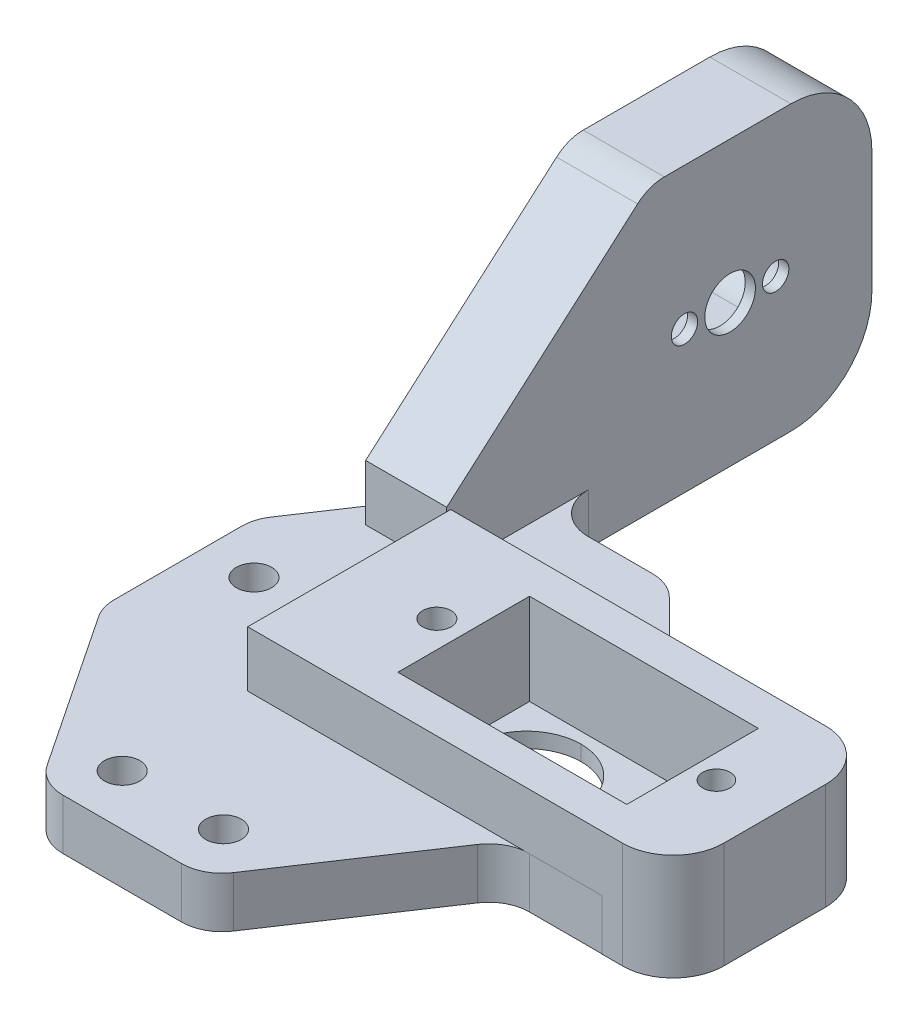
from build123d import *

# Parameters (mm, degrees)
BOSS_EXTRUDE1_DEPTH = 5
SKETCH2_R           = 1.75
SKETCH2_W           = 10.8
SKETCH2_H           = 10.8
CUT_EXTRUDE1_DEPTH  = 54.252895531
FILLET1_R           = 5.4
FILLET2_R           = 5.4
FILLET3_RADIUS      = 10
FILLET3_LENGTH      = 5
SKETCH6_W           = 35
SKETCH6_H           = 20.042215846
SKETCH6_W_2         = 23
SKETCH6_H_2         = 13
BOSS_EXTRUDE3_DEPTH = 5.5
SKETCH7_W           = 23
SKETCH7_H           = 13
CUT_EXTRUDE3_DEPTH  = 3.5
CUT_EXTRUDE4_DEPTH  = 54.302165833
SKETCH9_W           = 8
SKETCH9_H           = 28
BOSS_EXTRUDE4_DEPTH = 32
SKETCH11_R          = 2.5
SKETCH11_R_2        = 1.3
CUT_EXTRUDE5_DEPTH  = 69.854164991
FILLET6_R           = 8
BOSS_EXTRUDE5_DEPTH = 8
SKETCH13_W          = 14
SKETCH13_H          = 7
CUT_EXTRUDE6_DEPTH  = 7
FILLET7_R           = 3.5
FILLET8_R           = 3.5
CUT_EXTRUDE7_DEPTH  = 74.28896148
FILLET9_R           = 4
SKETCH15_W          = 5.3
SKETCH15_H          = 13
SKETCH15_R          = 1.4
BOSS_EXTRUDE6_DEPTH = 9
SKETCH16_W          = 7
SKETCH16_H          = 20.042215846
BOSS_EXTRUDE7_DEPTH = 10.5
SKETCH17_R          = 1.35
CUT_EXTRUDE8_DEPTH  = 9
FILLET10_R          = 5
SKETCH18_W          = 4.9
SKETCH18_H          = 13
CUT_EXTRUDE9_DEPTH  = 9


# Some blends are built 0.0001 mm under size
with BuildPart() as part:
    # Sketch1 → Boss-Extrude1 (new body)
    with BuildSketch(Plane(origin=(0, 0, 0), x_dir=(1, 0, 0), z_dir=(0, 1, 0))):
        Polygon((45, -10), (45, 10), (21, 10), (11.001510114, 19.998489886), (-4.998489886, 19.998489886), (-14.999716743, 4.996611292), (-14.999716743, -10.003388708), (-2.979747437, -28.033388708), (13.020252563, -28.033388708), (25.042481003, -10), align=None)
    extrude(amount=BOSS_EXTRUDE1_DEPTH)

    # Sketch2 → Cut-Extrude1 (cut, through all)
    with BuildSketch(Plane(origin=(0, 5, 0), x_dir=(1, 0, 0), z_dir=(0, 1, 0))):
        with Locations(Location((-9.999716743, 0, 0), (0, 0, 270))):
            Circle(SKETCH2_R)
        with Locations(Location((0.02138213, -23.033388708, 0), (0, 0, 270))):
            Circle(SKETCH2_R)
        with Locations(Location((10.02138213, -23.033388708, 0), (0, 0, 270))):
            Circle(SKETCH2_R)
        with Locations((16.9, 0)):
            Rectangle(SKETCH2_W, SKETCH2_H)
    extrude(amount=-CUT_EXTRUDE1_DEPTH, mode=Mode.SUBTRACT)

    # Fillet1
    fillet1_edges = [part.edges().sort_by_distance(p)[0] for p in [
        (11.5, 2.5, 5.4),
        (11.5, 2.5, -5.4),
    ]]
    fillet(fillet1_edges, radius=FILLET1_R - 0.0001)  # a hair under: the kernel refuses the full size

    # Fillet2
    # the kernel refuses this fillet: 5.4 mm, written as the material it adds along each edge
    with BuildSketch(Plane(origin=(22.3, 5, 5.4), x_dir=(-1, 0, 0), z_dir=(0, -1, 0)), Plane(origin=(22.3, 5, -5.4), x_dir=(0, 0, 1), z_dir=(0, -1, 0))) as fillet2_piece_1:
        with BuildLine():
            CenterArc((FILLET2_R, FILLET2_R), FILLET2_R, 180, 90)
            Line((0, FILLET2_R), (0, 0))
            Line((0, 0), (FILLET2_R, 0))
        make_face()
    extrude(amount=5)
    # the kernel refuses this fillet: 5.4 mm, written as the material it takes off along each edge

    # Fillet3: full round fillet: the end face becomes a half cylinder, R = half its width
    fillet3_face = Plane((45, 2.5, 0), x_dir=(0, 1, 0), z_dir=(1, 0, 0))  # on the end face: x along it, z out of the body
    fillet3_slab = fillet3_face.offset(-FILLET3_RADIUS / 2) * Box(FILLET3_LENGTH, 2 * FILLET3_RADIUS, FILLET3_RADIUS, mode=Mode.PRIVATE)  # the body's end, R deep
    fillet3_round = Plane((35, 2.5, 0), x_dir=(1, 0, 0), z_dir=(0, 1, 0)) * Cylinder(FILLET3_RADIUS, FILLET3_LENGTH, mode=Mode.PRIVATE)  # its axis R under the face
    add(fillet3_slab - fillet3_round, mode=Mode.SUBTRACT)

    # Sketch6 → Boss-Extrude3 (add)
    with BuildSketch(Plane(origin=(0, 5, 0), x_dir=(1, 0, 0), z_dir=(0, 1, 0))):
        with Locations((16.9, 0)):
            Rectangle(SKETCH6_W, SKETCH6_H)
        with Locations((16.9, 0)):
            Rectangle(SKETCH6_W_2, SKETCH6_H_2, mode=Mode.SUBTRACT)
    extrude(amount=BOSS_EXTRUDE3_DEPTH)

    # Sketch7 → Cut-Extrude3 (cut)
    with BuildSketch(Plane(origin=(0, 5, 0), x_dir=(1, 0, 0), z_dir=(0, 1, 0))):
        with Locations((16.9, 0)):
            Rectangle(SKETCH7_W, SKETCH7_H)
    extrude(amount=-CUT_EXTRUDE3_DEPTH, mode=Mode.SUBTRACT)

    # Sketch8 → Cut-Extrude4 (cut, through all)
    with BuildSketch(Plane(origin=(0, 5, 0), x_dir=(1, 0, 0), z_dir=(0, 1, 0))):
        with BuildLine():
            Line((34.4, 10), (34.4, -10))
            Line((34.4, -10), (35, -10))
            ThreePointArc((35, -10), (45, 0), (35, 10))
            Line((35, 10), (34.4, 10))
        make_face()
    extrude(amount=-CUT_EXTRUDE4_DEPTH, mode=Mode.SUBTRACT)

    # Sketch9 → Boss-Extrude4 (add)
    with BuildSketch(Plane(origin=(0, 0, -19.998489886), x_dir=(-1, 0, 0), z_dir=(0, 0, -1))):
        with Locations((4.998489886, 14)):
            Rectangle(SKETCH9_W, SKETCH9_H)
    extrude(amount=BOSS_EXTRUDE4_DEPTH)

    # Sketch11 → Cut-Extrude5 (cut, through all)
    with BuildSketch(Plane(origin=(-0.998489886, 0, 0), x_dir=(0, 0, -1), z_dir=(1, 0, 0))):
        with Locations((37.998489886, 14)):
            Circle(SKETCH11_R)
        with Locations((33.498489886, 14)):
            Circle(SKETCH11_R_2)
        with Locations((42.498489886, 14)):
            Circle(SKETCH11_R_2)
    extrude(amount=-CUT_EXTRUDE5_DEPTH, mode=Mode.SUBTRACT)

    # Fillet6
    fillet6_edges = [part.edges().sort_by_distance(p)[0] for p in [
        (-4.998489886, 0, -51.998489886),
        (-4.998489886, 28, -51.998489886),
    ]]
    fillet(fillet6_edges, radius=FILLET6_R)

    # Sketch12 → Boss-Extrude5 (add)
    with BuildSketch(Plane.ZY.offset(8.998489886)):
        Polygon((-10.021107923, 10.5), (-19.998489886, 28), (-19.998489886, 0), (-10, 0), align=None)
    extrude(amount=-BOSS_EXTRUDE5_DEPTH)

    # Sketch13 → Cut-Extrude6 (cut)
    with BuildSketch(Plane.ZY.offset(8.998489886)):
        with Locations((-37.998489886, 14)):
            Rectangle(SKETCH13_W, SKETCH13_H)
    extrude(amount=-CUT_EXTRUDE6_DEPTH, mode=Mode.SUBTRACT)

    # Fillet7
    fillet7_edges = [part.edges().sort_by_distance(p)[0] for p in [
        (-5.498489886, 10.5, -44.998489886),
        (-5.498489886, 17.5, -44.998489886),
    ]]
    fillet(fillet7_edges, radius=FILLET7_R - 0.0001)  # a hair under: the kernel refuses the full size

    # Fillet8
    fillet8_edges = [part.edges().sort_by_distance(p)[0] for p in [
        (-5.498489886, 17.5, -30.998489886),
        (-5.498489886, 10.5, -30.998489886),
    ]]
    fillet(fillet8_edges, radius=FILLET8_R - 0.0001)  # a hair under: the kernel refuses the full size

    # Sketch14 → Cut-Extrude7 (cut, through all)
    with BuildSketch(Plane.ZY.offset(8.998489886)):
        Polygon((-10.021107923, 10.5), (-29.998489886, 28), (-19.998489886, 28), align=None)
    extrude(amount=-CUT_EXTRUDE7_DEPTH, mode=Mode.SUBTRACT)

    # Fillet9
    # the kernel refuses this fillet: 4 mm, written as the material it adds along each edge
    with BuildSketch(Plane(origin=(-0.998489886, 5, -19.998489886), x_dir=(1, 0, 0), z_dir=(0, -1, 0))) as fillet9_piece_1:
        with BuildLine():
            CenterArc((FILLET9_R, -FILLET9_R), FILLET9_R, 90, 90)
            Line((0, -FILLET9_R), (0, 0))
            Line((0, 0), (FILLET9_R, 0))
        make_face()
    extrude(amount=5)
    with BuildSketch(Plane(origin=(25.042481003, 0, 10), x_dir=(-0.5546992156114033, 0, 0.8320509480795595), z_dir=(0, 1, 0))) as fillet9_piece_2:
        with BuildLine():
            CenterArc((FILLET9_R * 0.535184516545, FILLET9_R), FILLET9_R, 213.69, 56.31)
            Line((-FILLET9_R * 0.296866431535, FILLET9_R * 0.445300784389), (0, 0))
            Line((0, 0), (FILLET9_R * 0.535184516545, 0))
        make_face()
    extrude(amount=5)
    with BuildSketch(Plane(origin=(21, 0, -10), x_dir=(1, 0, 0), z_dir=(0, 1, 0))) as fillet9_piece_3:
        with BuildLine():
            CenterArc((FILLET9_R * 0.414213562373, FILLET9_R), FILLET9_R, 225, 45)
            Line((-FILLET9_R * 0.292893218813, FILLET9_R * 0.292893218813), (0, 0))
            Line((0, 0), (FILLET9_R * 0.414213562373, 0))
        make_face()
    extrude(amount=5)
    with BuildSketch(Plane(origin=(-8.998489886, 5, -13.998474565), x_dir=(0, 0, -1), z_dir=(0, -1, 0))) as fillet9_piece_4:
        with BuildLine():
            CenterArc((FILLET9_R * 0.302774994436, -FILLET9_R), FILLET9_R, 90, 33.69)
            Line((-FILLET9_R * 0.251924221175, -FILLET9_R * 0.16794905192), (0, 0))
            Line((0, 0), (FILLET9_R * 0.302774994436, 0))
        make_face()
    extrude(amount=5)
    # the kernel refuses this fillet: 4 mm, written as the material it takes off along each edge
    with BuildSketch(Plane(origin=(13.020252563, -5.351845165, 28.033388708), x_dir=(0.5546992156114035, 0, -0.8320509480795594), z_dir=(0, 1, 0)), Plane(origin=(-2.979747437, -5.351845165, 28.033388708), x_dir=(1, 0, 0), z_dir=(0, 1, 0))) as fillet9_2_piece_1:
        with BuildLine():
            CenterArc((FILLET9_R * 0.535184516545, FILLET9_R), FILLET9_R, 213.69, 56.31)
            Line((-FILLET9_R * 0.296866431535, FILLET9_R * 0.445300784389), (0, 0))
            Line((0, 0), (FILLET9_R * 0.535184516545, 0))
        make_face()
    extrude(amount=15.703690331, mode=Mode.SUBTRACT)
    with BuildSketch(Plane(origin=(-14.999716743, -3.027749944, 10.003388708), x_dir=(0.5546992156114036, 0, 0.8320509480795593), z_dir=(0, 1, 0)), Plane(origin=(-14.999716743, -3.027749944, -4.996611292), x_dir=(0, 0, 1), z_dir=(0, 1, 0))) as fillet9_2_piece_2:
        with BuildLine():
            CenterArc((FILLET9_R * 0.302774994436, FILLET9_R), FILLET9_R, 236.31, 33.69)
            Line((-FILLET9_R * 0.251924221175, FILLET9_R * 0.16794905192), (0, 0))
            Line((0, 0), (FILLET9_R * 0.302774994436, 0))
        make_face()
    extrude(amount=11.055499889, mode=Mode.SUBTRACT)
    with BuildSketch(Plane(origin=(11.001510114, -4.142135624, -19.998489886), x_dir=(-1, 0, 0), z_dir=(0, 1, 0))) as fillet9_2_piece_3:
        with BuildLine():
            CenterArc((FILLET9_R * 0.414213562373, FILLET9_R), FILLET9_R, 225, 45)
            Line((-FILLET9_R * 0.292893218813, FILLET9_R * 0.292893218813), (0, 0))
            Line((0, 0), (FILLET9_R * 0.414213562373, 0))
        make_face()
    extrude(amount=13.284271247, mode=Mode.SUBTRACT)
    with BuildSketch(Plane(origin=(-12.759041279, 28, -29.998489886), x_dir=(0, -0.658926553885557, 0.7522072829908683), z_dir=(1, 0, 0))) as fillet9_2_piece_4:
        with BuildLine():
            CenterArc((FILLET9_R * 0.376055139299, FILLET9_R), FILLET9_R, 228.781943012, 41.218056988)
            Line((-FILLET9_R * 0.282871414587, FILLET9_R * 0.247792717009), (0, 0))
            Line((0, 0), (FILLET9_R * 0.376055139299, 0))
        make_face()
    extrude(amount=15.521102786, mode=Mode.SUBTRACT)

    # Sketch15 → Boss-Extrude6 (add)
    with BuildSketch(Plane(origin=(0, 1.5, 0), x_dir=(1, 0, 0), z_dir=(0, 1, 0))):
        with Locations((8.05, 0)):
            Rectangle(SKETCH15_W, SKETCH15_H)
        with Locations(Location((8.05, 0, 0), (0, 0, 90))):
            Circle(SKETCH15_R, mode=Mode.SUBTRACT)
    extrude(amount=BOSS_EXTRUDE6_DEPTH)

    # Sketch16 → Boss-Extrude7 (add)
    with BuildSketch(Plane(origin=(0, 10.5, 0), x_dir=(1, 0, 0), z_dir=(0, 1, 0))):
        with Locations((37.9, 0)):
            Rectangle(SKETCH16_W, SKETCH16_H)
    extrude(amount=-BOSS_EXTRUDE7_DEPTH)

    # Sketch17 → Cut-Extrude8 (cut)
    with BuildSketch(Plane(origin=(0, 10.5, 0), x_dir=(1, 0, 0), z_dir=(0, 1, 0))):
        with Locations(Location((35.65, 0, 0), (0, 0, 270))):
            Circle(SKETCH17_R)
    extrude(amount=-CUT_EXTRUDE8_DEPTH, mode=Mode.SUBTRACT)

    # Fillet10
    fillet10_edges = [part.edges().sort_by_distance(p)[0] for p in [
        (41.4, 5.25, -10.021107923),
        (41.4, 5.25, 10.021107923),
    ]]
    fillet(fillet10_edges, radius=FILLET10_R)

    # Sketch18 → Cut-Extrude9 (cut)
    with BuildSketch(Plane(origin=(0, 10.5, 0), x_dir=(1, 0, 0), z_dir=(0, 1, 0))):
        with Locations((30.85, 0)):
            Rectangle(SKETCH18_W, SKETCH18_H)
    extrude(amount=-CUT_EXTRUDE9_DEPTH, mode=Mode.SUBTRACT)


solid = part.part
